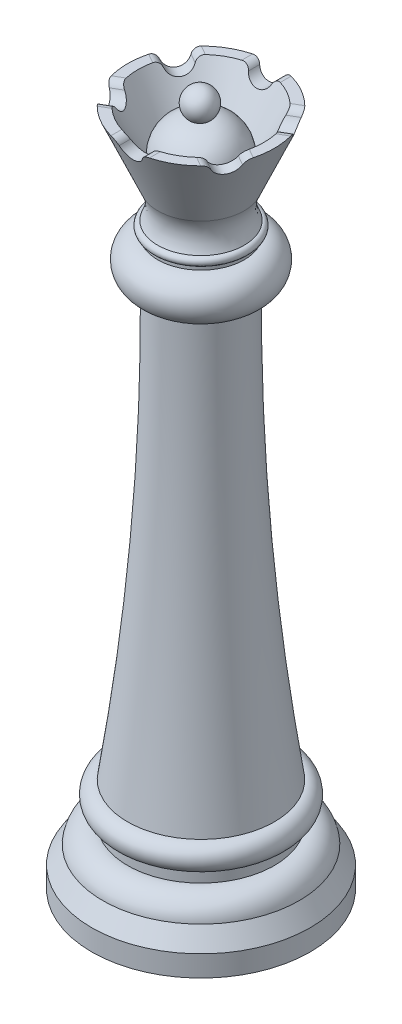
from build123d import *

# Parameters (mm, degrees)
SKETCH2_R           = 3.81
CUT_EXTRUDE4_DEPTH  = 2.54
CUT_EXTRUDE4_DRAFT  = -30
SKETCH4_R           = 0.762
CUT_EXTRUDE5_DEPTH  = 6.096
CIRPATTERN1_COUNT   = 6
SKETCH5_R           = 2.343530316
BOSS_EXTRUDE1_DEPTH = 2.032
FILLET7_R           = 2.032
FILLET8_R           = 0.508


with BuildPart() as part:
    # Sketch1 → Revolve1 (revolve)
    with BuildSketch(Plane.XY, mode=Mode.PRIVATE) as revolve1_sk:
        with BuildLine():
            Line((0, 40.980511704), (0, 0))
            Line((0, 0), (6.604, 0))
            Line((6.604, 0), (6.604, 1.27))
            Line((6.604, 1.27), (5.935118896, 2.349582359))
            ThreePointArc((5.935118896, 2.349582359), (5.421242729, 3.218435052), (4.435974388, 3.438025612))
            Line((4.435974388, 3.438025612), (4.435974388, 4.200025612))
            ThreePointArc((4.435974388, 4.200025612), (5.197974388, 4.962025612), (4.435974388, 5.724025612))
            add(Edge.make_bspline(
                [(4.435974388, 5.724025612), (2.482200661, 18.623404057), (2.593927336, 31.692795522)],
                knots=[0, 0, 0, 1, 1, 1], degree=2))
            ThreePointArc((2.593927336, 31.692795522), (3.87473742, 32.95189263), (2.615640312, 34.232702715))
            Line((2.615640312, 34.232702715), (2.615640312, 34.486702715))
            ThreePointArc((2.615640312, 34.486702715), (2.869640312, 34.740702715), (2.615640312, 34.994702715))
            add(Edge.make_bspline(
                [(2.615640312, 34.994702715), (2.122029944, 35.902114759), (2.607558943, 36.793850065)],
                knots=[0, 0, 0, 1, 1, 1], degree=2))
            Line((2.607558943, 36.793850065), (4.435974388, 40.980511704))
            Line((4.435974388, 40.980511704), (0.519244694, 40.980511704))
            Line((0.519244694, 40.980511704), (0, 40.980511704))
        make_face()
    revolve(revolve1_sk.sketch.rotate(Axis((0, 0, 0), (0, 1, 0)), 90), axis=Axis((0, 0, 0), (0, 1, 0)))


with BuildPart() as cut_extrude4_tool:
    # Sketch2 → Cut-Extrude4 (with draft: the straight prism first)
    with BuildSketch(Plane(origin=(0, 40.980511704, 0), x_dir=(1, 0, 0), z_dir=(0, 1, 0))):
        Circle(SKETCH2_R)
    extrude(amount=-CUT_EXTRUDE4_DEPTH)
    # Cut-Extrude4: the draft: its side faces are tilted about the plane it starts from
    cut_extrude4_sides = [cut_extrude4_tool.faces().sort_by_distance(p)[0] for p in [
        (-3.81, 39.710511704, 0),
    ]]
    draft(cut_extrude4_sides, Plane(origin=(0, 40.980511704, 0), x_dir=(1, 0, 0), z_dir=(0, 1, 0)), CUT_EXTRUDE4_DRAFT)


with BuildPart() as part_1:
    add(part.part)

    # Cut-Extrude4: cut by cut_extrude4_tool
    add(cut_extrude4_tool.part, mode=Mode.SUBTRACT)

    # Sketch4 → Cut-Extrude5 (cut)
    with BuildSketch(Plane.XY):
        with Locations((0, 40.980511704)):
            Circle(SKETCH4_R)
    cut_extrude5 = extrude(amount=-CUT_EXTRUDE5_DEPTH, mode=Mode.SUBTRACT)

    # CirPattern1: Cut-Extrude5 ×6 about axis
    cirpattern1_axis = Axis((0, 40.980511704, 0), (0, 1, 0))
    for i in range(1, CIRPATTERN1_COUNT):
        add(cut_extrude5.rotate(cirpattern1_axis, i * 360 / CIRPATTERN1_COUNT), mode=Mode.SUBTRACT)

    # Sketch5 → Boss-Extrude1 (add)
    with BuildSketch(Plane(origin=(0, 38.440511704, 0), x_dir=(1, 0, 0), z_dir=(0, 1, 0))):
        with Locations(Location((0, 0, 0), (0, 0, 270))):
            Circle(SKETCH5_R)
    extrude(amount=BOSS_EXTRUDE1_DEPTH)

    # Fillet7
    fillet7_edges = [part_1.edges().sort_by_distance(p)[0] for p in [
        (0, 40.472511704, -2.343530316),
    ]]
    fillet(fillet7_edges, radius=FILLET7_R - 0.0001)  # a hair under: the kernel refuses the full size

    # Sketch6 → Revolve2 (revolve)
    with BuildSketch(Plane.XY):
        with BuildLine():
            Line((-0.065182329, 41.996511704), (-0.065182329, 40.218511704))
            ThreePointArc((-0.065182329, 40.218511704), (-0.954182329, 41.107511704), (-0.065182329, 41.996511704))
        make_face()
    revolve(axis=Axis((-0.065182329, 41.996511704, 0), (0, -1, 0)))

    # Fillet8
    fillet8_edges = [part_1.edges().sort_by_distance(p)[0] for p in [
        (-3.127727699, 40.980511704, 2.685676239),
        (-3.889727699, 40.980511704, 1.365853524),
        (0.762, 40.980511704, 4.051529763),
        (-0.762, 40.980511704, 4.051529763),
        (3.889727699, 40.980511704, 1.365853524),
        (3.127727699, 40.980511704, 2.685676239),
        (3.127727699, 40.980511704, -2.685676239),
        (3.889727699, 40.980511704, -1.365853524),
        (-0.762, 40.980511704, -4.051529763),
        (0.762, 40.980511704, -4.051529763),
        (-3.889727699, 40.980511704, -1.365853524),
        (-3.127727699, 40.980511704, -2.685676239),
    ]]
    fillet(fillet8_edges, radius=FILLET8_R)


solid = part_1.part
